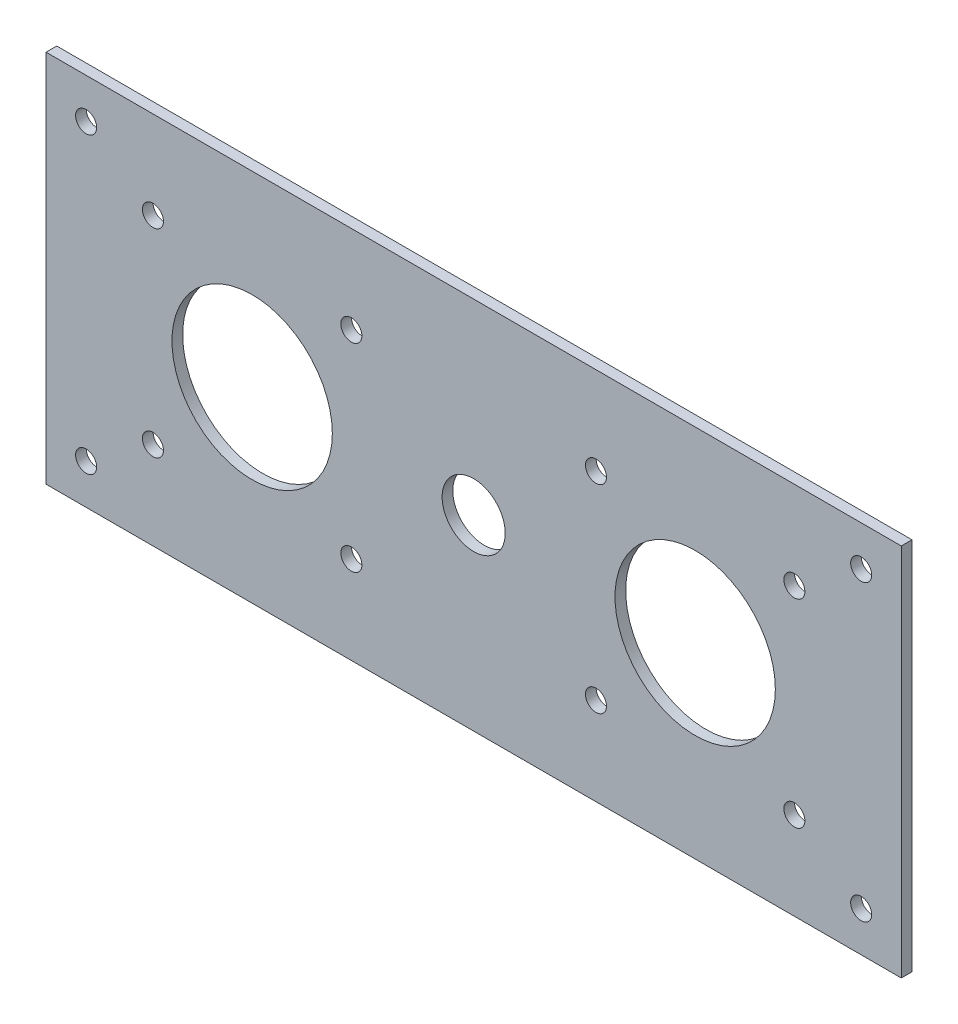
from build123d import *

# Parameters (mm, degrees)
SKETCH2_W               = 203.2
SKETCH2_H               = 88.9
SKETCH2_R               = 2.5
SKETCH2_R_2             = 19.05
BOSS_EXTRUDE1_DEPTH     = 1.27
SKETCH3_R               = 2.5
CUT_EXTRUDE1_DEPTH      = 111.92706658
CUT_EXTRUDE2_DEPTH      = 111.92706658
CUT_EXTRUDE2_DEPTH_BACK = 111.92706658
SKETCH4_R               = 7.5


with BuildPart() as part:
    # Sketch2 → Boss-Extrude1 (new, symmetric)
    with BuildSketch(Plane.XY):
        Rectangle(SKETCH2_W, SKETCH2_H)
        with Locations((-76.2, -23.57)):
            Circle(SKETCH2_R, mode=Mode.SUBTRACT)
        with Locations((-29.06, -23.57)):
            Circle(SKETCH2_R, mode=Mode.SUBTRACT)
        with Locations((-29.06, 23.57)):
            Circle(SKETCH2_R, mode=Mode.SUBTRACT)
        with Locations((-76.2, 23.57)):
            Circle(SKETCH2_R, mode=Mode.SUBTRACT)
        with Locations((29.06, 23.57)):
            Circle(SKETCH2_R, mode=Mode.SUBTRACT)
        with Locations((76.2, 23.57)):
            Circle(SKETCH2_R, mode=Mode.SUBTRACT)
        with Locations((29.06, -23.57)):
            Circle(SKETCH2_R, mode=Mode.SUBTRACT)
        with Locations((76.2, -23.57)):
            Circle(SKETCH2_R, mode=Mode.SUBTRACT)
        with Locations((-52.63, 0)):
            Circle(SKETCH2_R_2, mode=Mode.SUBTRACT)
        with Locations((52.63, 0)):
            Circle(SKETCH2_R_2, mode=Mode.SUBTRACT)
    extrude(amount=BOSS_EXTRUDE1_DEPTH, both=True)

    # Sketch3 → Cut-Extrude1 (cut, through all)
    with BuildSketch(Plane.XY.offset(1.27)):
        with Locations((-92.075, 34.925)):
            Circle(SKETCH3_R)
        with Locations((-92.075, -34.925)):
            Circle(SKETCH3_R)
        with Locations((92.075, -34.925)):
            Circle(SKETCH3_R)
        with Locations((92.075, 34.925)):
            Circle(SKETCH3_R)
    extrude(amount=-CUT_EXTRUDE1_DEPTH, mode=Mode.SUBTRACT)

    # Sketch4 → Cut-Extrude2 (cut, two sides: drawn at the far end of the back side and taken through both)
    with BuildSketch(Plane.XY.offset(1.27).offset(-CUT_EXTRUDE2_DEPTH_BACK)):
        Circle(SKETCH4_R)
    extrude(amount=CUT_EXTRUDE2_DEPTH + CUT_EXTRUDE2_DEPTH_BACK, mode=Mode.SUBTRACT)


solid = part.part
